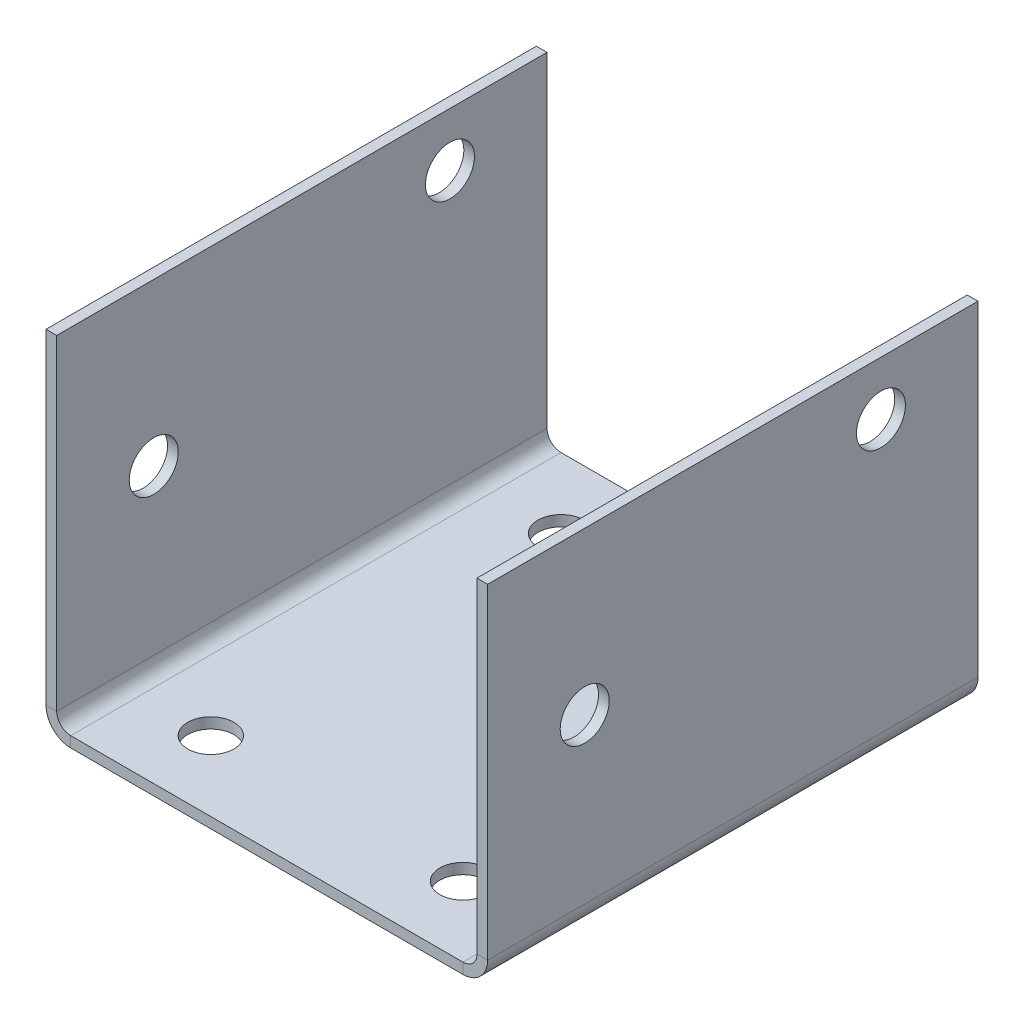
from build123d import *

# Parameters (mm, degrees)
SKETCH1_W                      = 60
SKETCH1_H                      = 70
BASE_FLANGE3_DEPTH             = 1.524
EDGE_FLANGE1_STRIP_W           = 10.096
EDGE_FLANGE1_STRIP_H           = 1.524
EDGE_FLANGE1_STRIP_CUT_DEPTH   = 70
EDGE_FLANGE1_STRIP_2_W         = 10.096
EDGE_FLANGE1_STRIP_2_H         = 1.524
EDGE_FLANGE1_STRIP_CUT_2_DEPTH = 70
EDGE_FLANGE1_DEPTH             = 70
EDGE_FLANGE1_BEND_DEPTH        = 70
F_7_0_7_DIAMETER_HOLE1_D       = 7
M6_CLEARANCE_HOLE1_D           = 6.6


# Sheet-metal steps are written as plain solids
with BuildPart() as part:
    # Sketch1 → Base-Flange3 (new body)
    with BuildSketch(Plane(origin=(0, 0, 0), x_dir=(1, 0, 0), z_dir=(0, 1, 0))):
        Rectangle(SKETCH1_W, SKETCH1_H)
    extrude(amount=-BASE_FLANGE3_DEPTH)

    # Edge-Flange1 strip (across the edge) → Edge-Flange1 strip cut (cut)
    with BuildSketch(Plane(origin=(-30, 0, -35), x_dir=(1, 0, 0), z_dir=(0, 0, 1))):
        with Locations((-3.048, -0.762)):
            Rectangle(EDGE_FLANGE1_STRIP_W, EDGE_FLANGE1_STRIP_H)
    extrude(amount=EDGE_FLANGE1_STRIP_CUT_DEPTH, mode=Mode.SUBTRACT)

    # Edge-Flange1 strip 2 (across the edge) → Edge-Flange1 strip cut 2 (cut)
    with BuildSketch(Plane(origin=(30, 0, 35), x_dir=(-1, 0, 0), z_dir=(0, 0, -1))):
        with Locations((-3.048, -0.762)):
            Rectangle(EDGE_FLANGE1_STRIP_2_W, EDGE_FLANGE1_STRIP_2_H)
    extrude(amount=EDGE_FLANGE1_STRIP_CUT_2_DEPTH, mode=Mode.SUBTRACT)

    # Edge-Flange1 section (across the edge) → Edge-Flange1 (add)
    with BuildSketch(Plane(origin=(-30, 0, -35), x_dir=(1, 0, 0), z_dir=(0, 0, 1))):
        with BuildLine():
            Line((-1.524, 2), (-1.524, 48.476))
            Line((-1.524, 48.476), (0, 48.476))
            Line((0, 48.476), (0, 2))
            ThreePointArc((0, 2), (0.585786438, 0.585786438), (2, 0))
            Line((2, 0), (2, -1.524))
            ThreePointArc((2, -1.524), (-0.491844297, -0.491844297), (-1.524, 2))
        make_face()
    extrude(amount=EDGE_FLANGE1_DEPTH)

    # Edge-Flange1 section 2 (across the edge) → Edge-Flange1 bend (add)
    with BuildSketch(Plane(origin=(30, 0, 35), x_dir=(-1, 0, 0), z_dir=(0, 0, -1))):
        with BuildLine():
            Line((-1.524, 2), (-1.524, 48.476))
            Line((-1.524, 48.476), (0, 48.476))
            Line((0, 48.476), (0, 2))
            ThreePointArc((0, 2), (0.585786438, 0.585786438), (2, 0))
            Line((2, 0), (2, -1.524))
            ThreePointArc((2, -1.524), (-0.491844297, -0.491844297), (-1.524, 2))
        make_face()
    extrude(amount=EDGE_FLANGE1_BEND_DEPTH)

    # Ø7.0 (7) Diameter Hole1 (through all)
    with Locations(Plane.ZY.offset(31.524)):
        with Locations((21.143083968, 25.4), (-21.143083968, 40.79090645)):
            Hole(F_7_0_7_DIAMETER_HOLE1_D / 2)

    # M6 Clearance Hole1 (through all)
    with Locations(Plane(origin=(0, 0, 0), x_dir=(1, 0, 0), z_dir=(0, 1, 0))):
        with Locations((-18, -25), (18, -25), (18, 25), (-18, 25)):
            Hole(M6_CLEARANCE_HOLE1_D / 2)


solid = part.part
